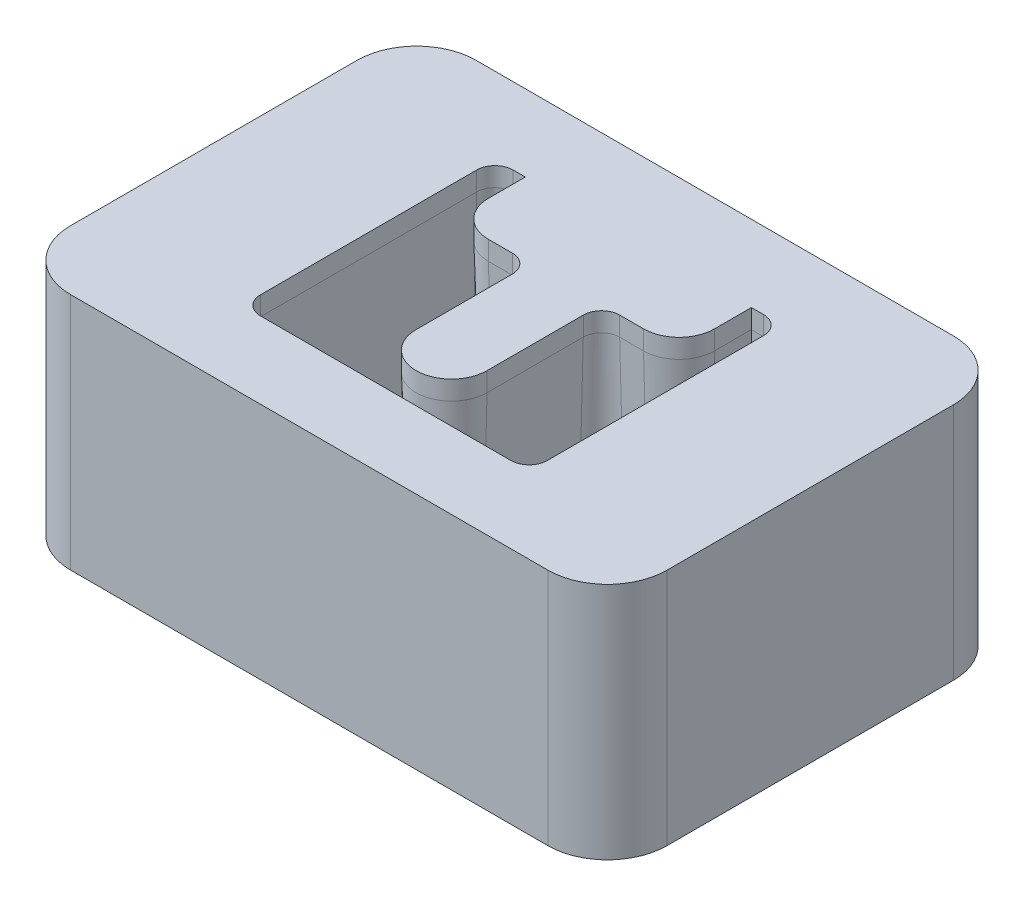
from build123d import *

# Parameters (mm, degrees)
SKETCH1_W                   = 100
SKETCH1_H                   = 68
BOSS_EXTRUDE1_DEPTH         = 40
FILLET1_R                   = 10
CUT_EXTRUDE1_REACH          = 74.498
M6_TAPPED_HOLE1_D           = 5
M6_TAPPED_HOLE1_DEPTH       = 17
M6_TAPPED_HOLE1_CSINK_D     = 6.05
M6_TAPPED_HOLE1_CSINK_ANGLE = 90
M6_TAPPED_HOLE1_TIP         = 1.502151548


with BuildPart() as part:
    # Sketch1 → Boss-Extrude1 (new body)
    with BuildSketch(Plane(origin=(0, 0, 0), x_dir=(1, 0, 0), z_dir=(0, 1, 0))):
        Rectangle(SKETCH1_W, SKETCH1_H)
    extrude(amount=-BOSS_EXTRUDE1_DEPTH)

    # Fillet1
    fillet1_edges = [part.edges().sort_by_distance(p)[0] for p in [
        (-50, -20, -34),
        (50, -20, -34),
        (50, -20, 34),
        (-50, -20, 34),
    ]]
    fillet(fillet1_edges, radius=FILLET1_R)

    # Sketch2 → Cut-Extrude1 (cut, up to next)
    with BuildSketch(Plane(origin=(0, 0, 0), x_dir=(1, 0, 0), z_dir=(0, 1, 0)), mode=Mode.PRIVATE) as cut_extrude1_sk1:
        with BuildLine():
            Line((-21, -21.18), (21, -21.18))
            ThreePointArc((21, -21.18), (23.156675683, -20.286675683), (24.05, -18.13))
            Line((24.05, -18.13), (24.05, 18.13))
            ThreePointArc((24.05, 18.13), (23.156675683, 20.286675683), (21, 21.18))
            Line((21, 21.18), (18.95, 21.18))
            Line((18.95, 21.18), (18.95, 15))
            ThreePointArc((18.95, 15), (17.207285348, 10.792714652), (13, 9.05))
            Line((13, 9.05), (9, 9.05))
            ThreePointArc((9, 9.05), (6.843324317, 8.156675683), (5.95, 6))
            Line((5.95, 6), (5.95, -10.13))
            ThreePointArc((5.95, -10.13), (0, -16.08), (-5.95, -10.13))
            Line((-5.95, -10.13), (-5.95, 6))
            ThreePointArc((-5.95, 6), (-6.843324317, 8.156675683), (-9, 9.05))
            Line((-9, 9.05), (-13, 9.05))
            ThreePointArc((-13, 9.05), (-17.207285348, 10.792714652), (-18.95, 15))
            Line((-18.95, 15), (-18.95, 21.18))
            Line((-18.95, 21.18), (-21, 21.18))
            ThreePointArc((-21, 21.18), (-23.156675683, 20.286675683), (-24.05, 18.13))
            Line((-24.05, 18.13), (-24.05, -18.13))
            ThreePointArc((-24.05, -18.13), (-23.156675683, -20.286675683), (-21, -21.18))
        make_face()
    cut_extrude1_tool1 = extrude(cut_extrude1_sk1.sketch, amount=-CUT_EXTRUDE1_REACH, mode=Mode.PRIVATE) & part.part
    add(cut_extrude1_tool1.solids().sort_by_distance((0, 0, 20.539065))[0], mode=Mode.SUBTRACT)

    # Cut-Sweep1: sweep along a path in Sketch5
    with BuildLine(Plane(origin=(0, 0, 0), x_dir=(1, 0, 0), z_dir=(0, 1, 0))) as cut_sweep1_path:
        Line((-21, -21.18), (21, -21.18))
        ThreePointArc((21, -21.18), (23.156675683, -20.286675683), (24.05, -18.13))
        Line((24.05, -18.13), (24.05, 18.13))
        ThreePointArc((24.05, 18.13), (23.156675683, 20.286675683), (21, 21.18))
        Line((21, 21.18), (18.95, 21.18))
        Line((18.95, 21.18), (18.95, 15))
        ThreePointArc((18.95, 15), (17.207285348, 10.792714652), (13, 9.05))
        Line((13, 9.05), (9, 9.05))
        ThreePointArc((9, 9.05), (6.843324317, 8.156675683), (5.95, 6))
        Line((5.95, 6), (5.95, -10.13))
        ThreePointArc((5.95, -10.13), (0, -16.08), (-5.95, -10.13))
        Line((-5.95, -10.13), (-5.95, 6))
        ThreePointArc((-5.95, 6), (-6.843324317, 8.156675683), (-9, 9.05))
        Line((-9, 9.05), (-13, 9.05))
        ThreePointArc((-13, 9.05), (-17.207285348, 10.792714652), (-18.95, 15))
        Line((-18.95, 15), (-18.95, 21.18))
        Line((-18.95, 21.18), (-21, 21.18))
        ThreePointArc((-21, 21.18), (-23.156675683, 20.286675683), (-24.05, 18.13))
        Line((-24.05, 18.13), (-24.05, -18.13))
        ThreePointArc((-24.05, -18.13), (-23.156675683, -20.286675683), (-21, -21.18))
    # Sketch3 → Cut-Sweep1 (sweep, cut)
    with BuildSketch(Plane.XY):
        Polygon((24.05, -3.2), (25.013641914, -40), (23.05, -40), (23.05, -3.2), align=None)
    sweep(path=cut_sweep1_path.line, transition=Transition.RIGHT, mode=Mode.SUBTRACT)

    # M6 Tapped Hole1
    with Locations(Plane(origin=(0, -40, 0), x_dir=(-1, 0, 0), z_dir=(0, -1, 0))):
        with Locations((-43, 27), (43, 27), (43, -27), (-43, -27)):
            CounterSinkHole(M6_TAPPED_HOLE1_D / 2, M6_TAPPED_HOLE1_CSINK_D / 2, depth=M6_TAPPED_HOLE1_DEPTH, counter_sink_angle=M6_TAPPED_HOLE1_CSINK_ANGLE)
            with Locations((0, 0, -(M6_TAPPED_HOLE1_DEPTH + M6_TAPPED_HOLE1_TIP / 2))):  # 118° drill point
                Cone(0, M6_TAPPED_HOLE1_D / 2, M6_TAPPED_HOLE1_TIP, mode=Mode.SUBTRACT)


solid = part.part
